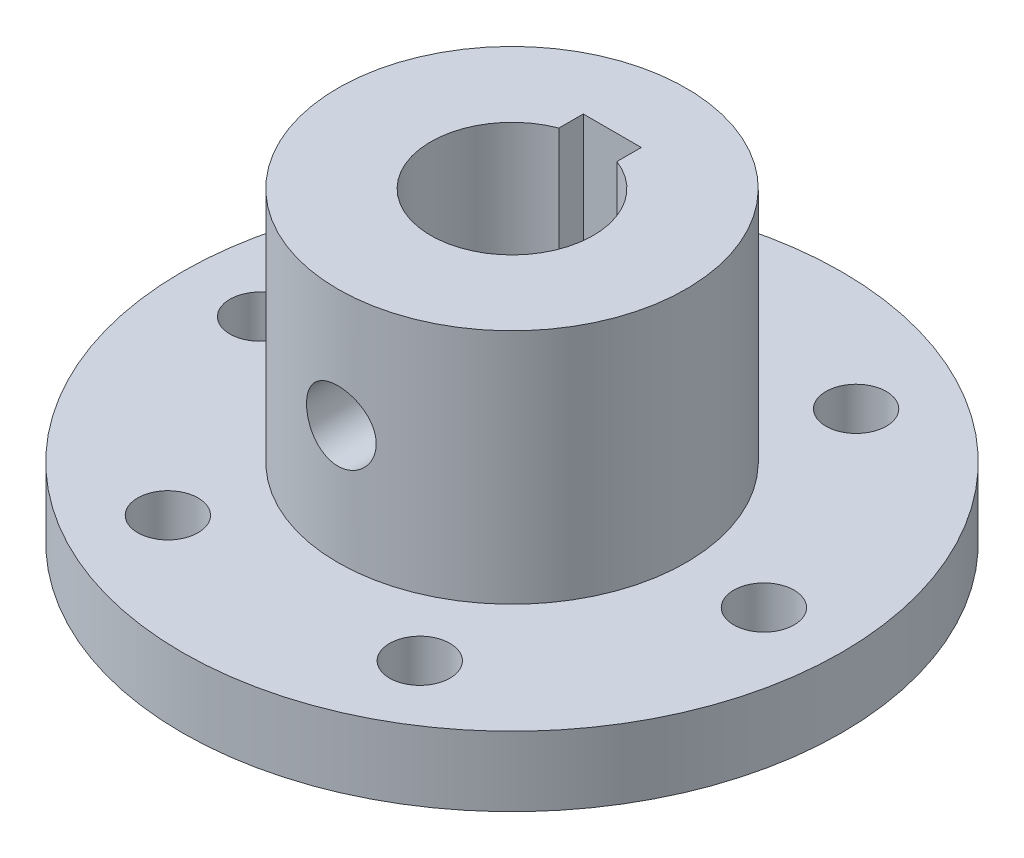
from build123d import *

# Parameters (mm, degrees)
SKETCH1_R           = 28.4
BOSS_EXTRUDE1_DEPTH = 6
SKETCH2_R           = 15
BOSS_EXTRUDE2_DEPTH = 20.4
CUT_EXTRUDE1_DEPTH  = 49.063291606
SKETCH4_R           = 3
CUT_EXTRUDE2_DEPTH  = 49.063291606
SKETCH5_R           = 2.6
CUT_EXTRUDE3_DEPTH  = 46.047530499
CIRPATTERN1_COUNT   = 6


with BuildPart() as part:
    # Sketch1 → Boss-Extrude1 (new body)
    with BuildSketch(Plane(origin=(0, 0, 0), x_dir=(1, 0, 0), z_dir=(0, 1, 0))):
        Circle(SKETCH1_R)
    extrude(amount=BOSS_EXTRUDE1_DEPTH)

    # Sketch2 → Boss-Extrude2 (add)
    with BuildSketch(Plane(origin=(0, 6, 0), x_dir=(1, 0, 0), z_dir=(0, 1, 0))):
        Circle(SKETCH2_R)
    extrude(amount=BOSS_EXTRUDE2_DEPTH)

    # Sketch3 → Cut-Extrude1 (cut, through all)
    with BuildSketch(Plane(origin=(0, 26.4, 0), x_dir=(1, 0, 0), z_dir=(0, 1, 0))):
        with BuildLine():
            Line((-2.5, 8.638348415), (2.5, 8.638348415))
            Line((2.5, 8.638348415), (2.5, 6.538348415))
            ThreePointArc((2.5, 6.538348415), (0, -7), (-2.5, 6.538348415))
            Line((-2.5, 6.538348415), (-2.5, 8.638348415))
        make_face()
    extrude(amount=-CUT_EXTRUDE1_DEPTH, mode=Mode.SUBTRACT)

    # Sketch4 → Cut-Extrude2 (cut, through all)
    with BuildSketch(Plane.XY):
        with Locations((0, 16.2)):
            Circle(SKETCH4_R)
    extrude(amount=CUT_EXTRUDE2_DEPTH, mode=Mode.SUBTRACT)

    # Sketch5 → Cut-Extrude3 (cut, through all)
    with BuildSketch(Plane(origin=(0, 6, 0), x_dir=(1, 0, 0), z_dir=(0, 1, 0))):
        with Locations((-21.7, 0)):
            Circle(SKETCH5_R)
    cut_extrude3 = extrude(amount=-CUT_EXTRUDE3_DEPTH, mode=Mode.SUBTRACT)

    # CirPattern1: Cut-Extrude3 ×6 about axis
    cirpattern1_axis = Axis((0, 6, 0), (0, 1, 0))
    for i in range(1, CIRPATTERN1_COUNT):
        add(cut_extrude3.rotate(cirpattern1_axis, i * 360 / CIRPATTERN1_COUNT), mode=Mode.SUBTRACT)


solid = part.part
